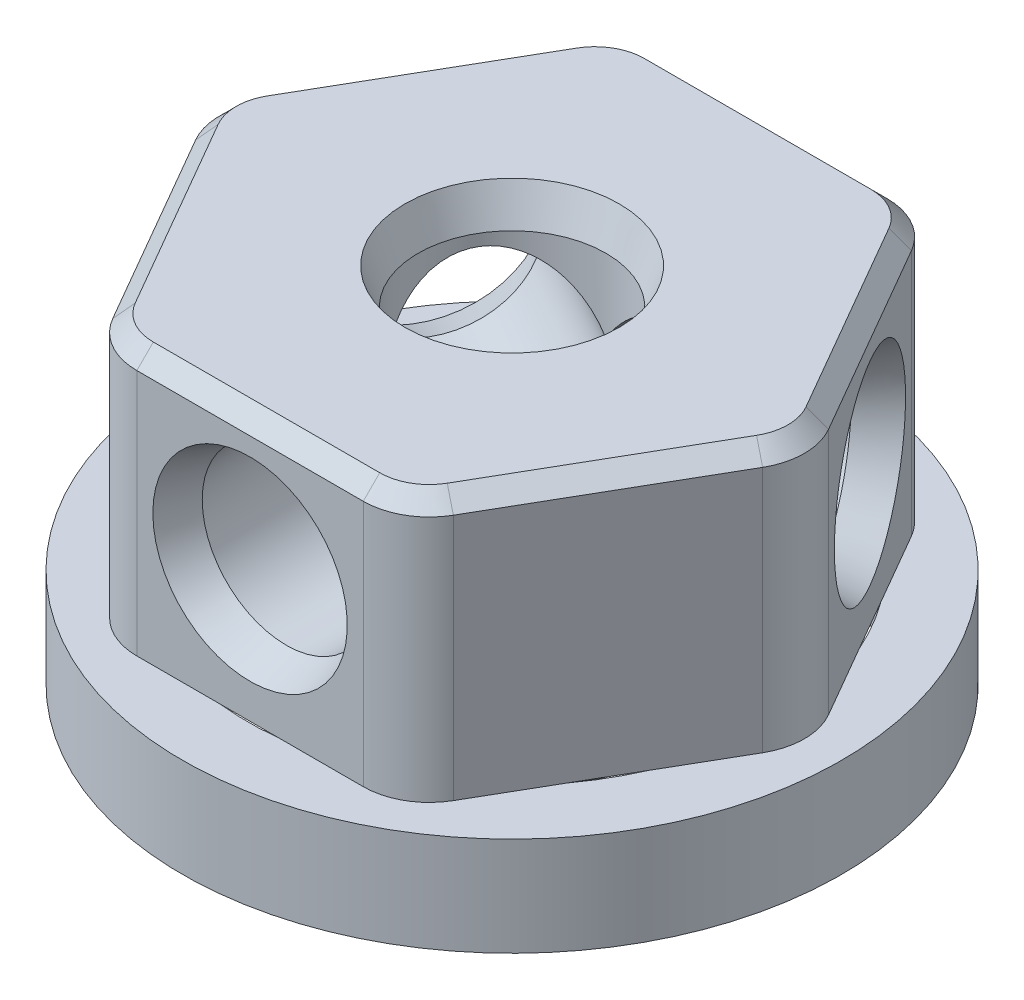
from build123d import *
from OCP.BRepFilletAPI import BRepFilletAPI_MakeChamfer

# Parameters (mm, degrees)
SKETCH1_R               = 2.85
BOSS_EXTRUDE1_DEPTH     = 8
CUT_EXTRUDE1_REACH      = 22.027
CUT_EXTRUDE1_END_RADIUS = 2.85
SKETCH2_R               = 2.55
CIRPATTERN1_COUNT       = 3
CHAMFER1_SIZE           = 0.4
CHAMFER1_SIZE2          = 1.098990968
FILLET1_R               = 2
SKETCH3_R               = 10
BOSS_EXTRUDE2_DEPTH     = 3
SKETCH4_R               = 8
SKETCH4_R_2             = 7
CUT_EXTRUDE2_DEPTH      = 3
CHAMFER3_SIZE           = 3
CHAMFER2_SIZE           = 0.5


with BuildPart() as part:
    # Sketch1 → Boss-Extrude1 (new body)
    with BuildSketch(Plane(origin=(0, 0, 0), x_dir=(1, 0, 0), z_dir=(0, 1, 0))):
        Polygon((-4.58993464, 7.95), (4.58993464, 7.95), (9.17986928, 0), (4.58993464, -7.95), (-4.58993464, -7.95), (-9.17986928, 0), align=None)
        with Locations(Location((0, 0, 0), (0, 0, 270))):
            Circle(SKETCH1_R, mode=Mode.SUBTRACT)
    extrude(amount=BOSS_EXTRUDE1_DEPTH)

    # Cut-Extrude1: up to this cylinder (the profile starts outside it)
    cut_extrude1_end = Plane(origin=(0, 4, 0), z_dir=(0, -1, 0)) * Cylinder(CUT_EXTRUDE1_END_RADIUS, 50.754, mode=Mode.PRIVATE)
    # Sketch2 → Cut-Extrude1 (cut, up to the surface)
    with BuildSketch(Plane.XY.offset(7.95), mode=Mode.PRIVATE) as cut_extrude1_sk1:
        with Locations((0, 4)):
            Circle(SKETCH2_R)
    cut_extrude1_tool1 = extrude(cut_extrude1_sk1.sketch, amount=-CUT_EXTRUDE1_REACH, mode=Mode.PRIVATE) - cut_extrude1_end
    cut_extrude1 = cut_extrude1_tool1.solids().sort_by_distance((0, 4, 7.95))[0]
    add(cut_extrude1, mode=Mode.SUBTRACT)

    # CirPattern1: Cut-Extrude1 ×3 about axis
    cirpattern1_axis = Axis((0, 8, 0), (0, -1, 0))
    for i in range(1, CIRPATTERN1_COUNT):
        add(cut_extrude1.rotate(cirpattern1_axis, i * 360 / CIRPATTERN1_COUNT), mode=Mode.SUBTRACT)

    # Chamfer1: one chamfer whose edges measure the first distance from different faces: ONE call of the kernel's chamfer builder (chamfer() names one face for all edges)
    chamfer1_edges_1 = [part.edges().sort_by_distance(p)[0] for p in [
        (0, 8, -2.85),
    ]]
    chamfer1_side_1 = [part.faces().sort_by_distance(p)[0] for p in [
        (0, 8, -7.707123488),
    ]]
    chamfer1_edges_2 = [part.edges().sort_by_distance(p)[0] for p in [
        (-2.55, 4, 7.95),
    ]]
    chamfer1_side_2 = [part.faces().sort_by_distance(p)[0] for p in [
        (4.468168471, 4, 7.95),
    ]]
    chamfer1_edges_3 = [part.edges().sort_by_distance(p)[0] for p in [
        (-5.60990196, 4, -6.18336478),
    ]]
    chamfer1_side_3 = [part.faces().sort_by_distance(p)[0] for p in [
        (-9.118986195, 4, -0.105452596),
    ]]
    chamfer1_edges_4 = [part.edges().sort_by_distance(p)[0] for p in [
        (8.15990196, 4, -1.76663522),
    ]]
    chamfer1_side_4 = [part.faces().sort_by_distance(p)[0] for p in [
        (4.650817725, 4, -7.844547404),
    ]]
    chamfer1 = BRepFilletAPI_MakeChamfer(part.part.solid().wrapped)
    for e in chamfer1_edges_1:
        chamfer1.Add(CHAMFER1_SIZE, CHAMFER1_SIZE2, e.wrapped, chamfer1_side_1[0].wrapped)  # the first distance lies on this face
    for e in chamfer1_edges_2:
        chamfer1.Add(CHAMFER1_SIZE, CHAMFER1_SIZE2, e.wrapped, chamfer1_side_2[0].wrapped)  # the first distance lies on this face
    for e in chamfer1_edges_3:
        chamfer1.Add(CHAMFER1_SIZE, CHAMFER1_SIZE2, e.wrapped, chamfer1_side_3[0].wrapped)  # the first distance lies on this face
    for e in chamfer1_edges_4:
        chamfer1.Add(CHAMFER1_SIZE, CHAMFER1_SIZE2, e.wrapped, chamfer1_side_4[0].wrapped)  # the first distance lies on this face
    add(Compound.cast(chamfer1.Shape()), mode=Mode.REPLACE)

    # Fillet1
    fillet1_edges = [part.edges().sort_by_distance(p)[0] for p in [
        (-4.58993464, 4, 7.95),
        (-9.17986928, 4, 0),
        (-4.58993464, 4, -7.95),
        (4.58993464, 4, -7.95),
        (9.17986928, 4, 0),
        (4.58993464, 4, 7.95),
    ]]
    fillet(fillet1_edges, radius=FILLET1_R)

    # Sketch3 → Boss-Extrude2 (add)
    with BuildSketch(Plane.XZ):
        with Locations(Location((0, 0, 0), (0, 0, 270))):
            Circle(SKETCH3_R)
    extrude(amount=BOSS_EXTRUDE2_DEPTH)

    # Sketch4 → Cut-Extrude2 (cut)
    with BuildSketch(Plane.XZ.offset(3)):
        with Locations(Location((0, 0, 0), (0, 0, 270))):
            Circle(SKETCH4_R)
        with Locations(Location((0, 0, 0), (0, 0, 270))):
            Circle(SKETCH4_R_2, mode=Mode.SUBTRACT)
    extrude(amount=-CUT_EXTRUDE2_DEPTH, mode=Mode.SUBTRACT)

    # Chamfer3
    chamfer3_edges = [part.edges().sort_by_distance(p)[0] for p in [
        (0, -3, 7),
    ]]
    chamfer(chamfer3_edges, length=CHAMFER3_SIZE - 0.0001)  # a hair under: the kernel refuses the full size

    # Chamfer2
    chamfer2_edges = [part.edges().sort_by_distance(p)[0] for p in [
        (-6.88490196, 8, 3.975),
        (-6.88490196, 8, -3.975),
        (0, 8, 7.95),
        (6.88490196, 8, 3.975),
        (6.88490196, 8, -3.975),
        (0, 8, -7.95),
        (4.435234102, 8, -7.682050808),
        (-4.435234102, 8, -7.682050808),
        (8.870468203, 8, 0),
        (4.435234102, 8, 7.682050808),
        (-4.435234102, 8, 7.682050808),
        (-8.870468203, 8, 0),
    ]]
    chamfer(chamfer2_edges, length=CHAMFER2_SIZE)


solid = part.part
